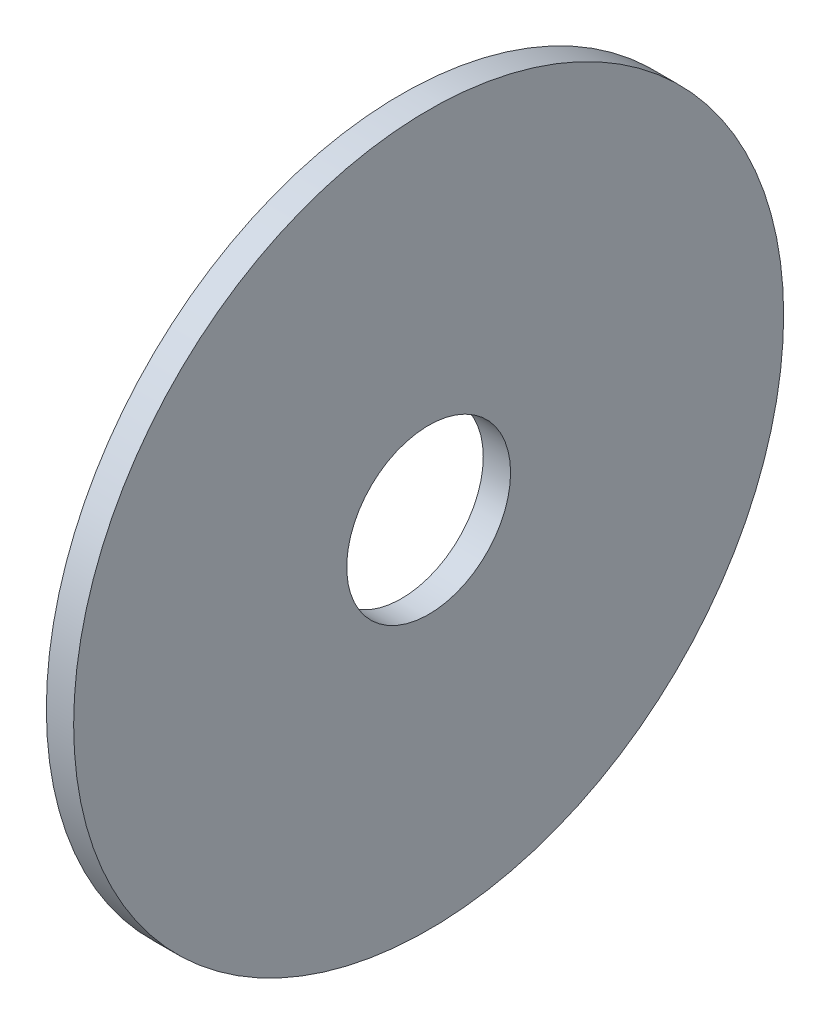
from build123d import *

# Parameters (mm, degrees)
SKETCH_1_R             = 39
SKETCH_1_R_2           = 9
SM_BASE_FLANGE_1_DEPTH = 3


# Sheet-metal steps are written as plain solids
with BuildPart() as part:
    # Sketch 1 → Базовая кромка1 (new body)
    with BuildSketch(Plane(origin=(0, 0, 0), x_dir=(0, 0, -1), z_dir=(1, 0, 0))):
        Circle(SKETCH_1_R)
        Circle(SKETCH_1_R_2, mode=Mode.SUBTRACT)
    extrude(amount=-SM_BASE_FLANGE_1_DEPTH)


solid = part.part
